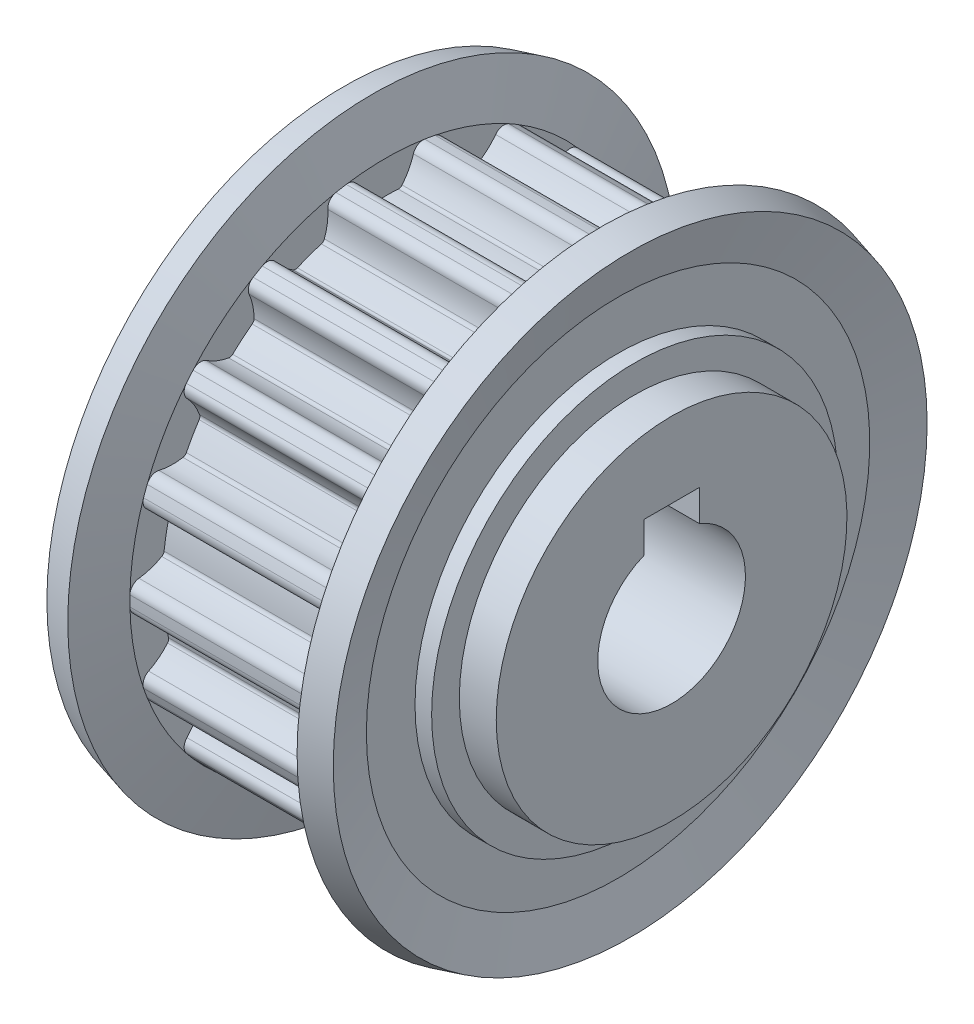
from build123d import *

# Parameters (mm, degrees)
SKETCH_2_W           = 25
SKETCH_2_H           = 4
CUT_EXTRUDE_1_DEPTH  = 11
CUT_EXTRUDE_2_DEPTH  = 11
CUT_EXTRUDE_3_DEPTH  = 11
CUT_EXTRUDE_4_DEPTH  = 11
CUT_EXTRUDE_5_DEPTH  = 11
CUT_EXTRUDE_6_DEPTH  = 11
CUT_EXTRUDE_7_DEPTH  = 11
CUT_EXTRUDE_8_DEPTH  = 11
CUT_EXTRUDE_9_DEPTH  = 11
CUT_EXTRUDE_10_DEPTH = 11
CUT_EXTRUDE_11_DEPTH = 11
CUT_EXTRUDE_12_DEPTH = 11
CUT_EXTRUDE_13_DEPTH = 11
CUT_EXTRUDE_14_DEPTH = 11
CUT_EXTRUDE_15_DEPTH = 11
CUT_EXTRUDE_16_DEPTH = 11
CUT_EXTRUDE_17_DEPTH = 11
CUT_EXTRUDE_18_DEPTH = 11
SKETCH_21_W          = 3
SKETCH_21_H          = 5.4
CUT_EXTRUDE_19_DEPTH = 25
SKETCH_22_W          = 1.621
SKETCH_22_H          = 9.5
SKETCH_24_W          = 7
SKETCH_24_H          = 9.5


with BuildPart() as part:
    # 스케치1 → 회전1 (revolve)
    with BuildSketch(Plane.XY):
        Polygon((0, 0), (0, 11), (0.9, 11), (0.9, 13.634356004), (0.243113572, 16.085889528), (1.788594894, 16.5), (2.5, 13.845), (13.5, 13.845), (14.211405106, 16.5), (15.756886428, 16.085889528), (15.1, 13.634356004), (15.1, 11), (16, 11), (16, 9.5), (25, 9.5), (25, 0), align=None)
    revolve(axis=Axis((25, 0, 0), (-1, 0, 0)))

    # 스케치2 → 컷-회전1 (revolve, cut)
    with BuildSketch(Plane.XY):
        with Locations((12.5, 2)):
            Rectangle(SKETCH_2_W, SKETCH_2_H)
    revolve(axis=Axis((25, 0, 0), (-1, 0, 0)), mode=Mode.SUBTRACT)

    # 스케치3 → 컷-돌출1 (cut)
    with BuildSketch(Plane(origin=(2.5, 0, 0), x_dir=(0, 0, -1), z_dir=(1, 0, 0))):
        with BuildLine():
            Line((2.1243151, 13.681056624), (2.1243151, 14.166612522))
            ThreePointArc((2.1243151, 14.166612522), (0, 14.325), (-2.1243151, 14.166612522))
            Line((-2.1243151, 14.166612522), (-2.1243151, 13.681056624))
            ThreePointArc((-2.1243151, 13.681056624), (-1.746277471, 13.602618612), (-1.512942792, 13.295015136))
            ThreePointArc((-1.512942792, 13.295015136), (-1.263642967, 12.689365371), (-0.89881438, 12.145433258))
            ThreePointArc((-0.89881438, 12.145433258), (-0.806096067, 12.075598583), (-0.691833137, 12.055164533))
            ThreePointArc((-0.691833137, 12.055164533), (-6e-09, 12.075), (0.691833126, 12.055164533))
            ThreePointArc((0.691833126, 12.055164533), (0.806096062, 12.07559858), (0.89881438, 12.145433258))
            ThreePointArc((0.89881438, 12.145433258), (1.263642967, 12.689365371), (1.512942792, 13.295015136))
            ThreePointArc((1.512942792, 13.295015136), (1.746277471, 13.602618612), (2.1243151, 13.681056624))
        make_face()
    extrude(amount=CUT_EXTRUDE_1_DEPTH, mode=Mode.SUBTRACT)

    # 스케치4 → 컷-돌출2 (cut)
    with BuildSketch(Plane(origin=(2.5, 0, 0), x_dir=(0, 0, -1), z_dir=(1, 0, 0))):
        with BuildLine():
            Line((6.675400171, 12.1294294), (6.841470069, 12.585702694))
            ThreePointArc((6.841470069, 12.585702694), (4.899438553, 13.461096793), (2.849063622, 14.038819804))
            Line((2.849063622, 14.038819804), (2.682993724, 13.582546509))
            ThreePointArc((2.682993724, 13.582546509), (3.011405514, 13.379542404), (3.125461805, 13.010684527))
            ThreePointArc((3.125461805, 13.010684527), (3.152582591, 12.35629435), (3.309373584, 11.720386632))
            ThreePointArc((3.309373584, 11.720386632), (3.372615432, 11.623051972), (3.472998607, 11.564770023))
            ThreePointArc((3.472998607, 11.564770023), (4.129893225, 11.346788398), (4.773219585, 11.091528289))
            ThreePointArc((4.773219585, 11.091528289), (4.887580478, 11.071649787), (4.998592064, 11.105561386))
            ThreePointArc((4.998592064, 11.105561386), (5.527454534, 11.491911653), (5.96886416, 11.975770706))
            ThreePointArc((5.96886416, 11.975770706), (6.29333362, 12.185018263), (6.675400171, 12.1294294))
        make_face()
    extrude(amount=CUT_EXTRUDE_2_DEPTH, mode=Mode.SUBTRACT)

    # 스케치5 → 컷-돌출3 (cut)
    with BuildSketch(Plane(origin=(2.5, 0, 0), x_dir=(0, 0, -1), z_dir=(1, 0, 0))):
        with BuildLine():
            Line((10.421333463, 9.114813978), (10.733442778, 9.486771375))
            ThreePointArc((10.733442778, 9.486771375), (9.207932509, 10.973586648), (7.478803223, 12.217738226))
            Line((7.478803223, 12.217738226), (7.166693908, 11.845780828))
            ThreePointArc((7.166693908, 11.845780828), (7.405868551, 11.542695921), (7.386889582, 11.157073347))
            ThreePointArc((7.386889582, 11.157073347), (7.188560162, 10.532871871), (7.118402252, 9.881688403))
            ThreePointArc((7.118402252, 9.881688403), (7.144539736, 9.768593756), (7.218935464, 9.67949357))
            ThreePointArc((7.218935464, 9.67949357), (7.761660383, 9.249986654), (8.278885317, 8.79009004))
            ThreePointArc((8.278885317, 8.79009004), (8.379550556, 8.732296629), (8.495465774, 8.72619491))
            ThreePointArc((8.495465774, 8.72619491), (9.124573508, 8.908363787), (9.704852419, 9.212071586))
            ThreePointArc((9.704852419, 9.212071586), (10.081320856, 9.297724879), (10.421333463, 9.114813978))
        make_face()
    extrude(amount=CUT_EXTRUDE_3_DEPTH, mode=Mode.SUBTRACT)

    # 스케치6 → 컷-돌출4 (cut)
    with BuildSketch(Plane(origin=(2.5, 0, 0), x_dir=(0, 0, -1), z_dir=(1, 0, 0))):
        with BuildLine():
            Line((12.910300137, 5.00081747), (13.33080388, 5.243595419))
            ThreePointArc((13.33080388, 5.243595419), (12.405813909, 7.1625), (11.20648878, 8.923017103))
            Line((11.20648878, 8.923017103), (10.785985037, 8.680239154))
            ThreePointArc((10.785985037, 8.680239154), (10.907074541, 8.313629958), (10.757349456, 7.95775446))
            ThreePointArc((10.757349456, 7.95775446), (10.357491286, 7.439029596), (10.068846552, 6.851112715))
            ThreePointArc((10.068846552, 6.851112715), (10.054727105, 6.735898963), (10.094162163, 6.626727338))
            ThreePointArc((10.094162163, 6.626727338), (10.457256748, 6.037500005), (10.785995296, 5.428437204))
            ThreePointArc((10.785995296, 5.428437204), (10.860823167, 5.339699623), (10.967660932, 5.294320543))
            ThreePointArc((10.967660932, 5.294320543), (11.621134253, 5.250335775), (12.270292248, 5.337260676))
            ThreePointArc((12.270292248, 5.337260676), (12.653352012, 5.288988655), (12.910300137, 5.00081747))
        make_face()
    extrude(amount=CUT_EXTRUDE_4_DEPTH, mode=Mode.SUBTRACT)

    # 스케치7 → 컷-돌출5 (cut)
    with BuildSketch(Plane(origin=(2.5, 0, 0), x_dir=(0, 0, -1), z_dir=(1, 0, 0))):
        with BuildLine():
            Line((13.842094079, 0.283648571), (14.320273292, 0.367964468))
            ThreePointArc((14.320273292, 0.367964468), (14.107371062, 2.487510145), (13.5825064, 4.552048428))
            Line((13.5825064, 4.552048428), (13.104327187, 4.467732531))
            ThreePointArc((13.104327187, 4.467732531), (13.09272637, 4.081817526), (12.830314224, 3.798612942))
            ThreePointArc((12.830314224, 3.798612942), (12.2771561, 3.447930563), (11.804839357, 2.994191722))
            ThreePointArc((11.804839357, 2.994191722), (11.752165994, 2.890755344), (11.751883932, 2.77467999))
            ThreePointArc((11.751883932, 2.77467999), (11.891553617, 2.096801751), (11.992155058, 1.412034726))
            ThreePointArc((11.992155058, 1.412034726), (12.032120216, 1.303056037), (12.116994316, 1.223872983))
            ThreePointArc((12.116994316, 1.223872983), (12.716014696, 0.959039781), (13.355753741, 0.818697359))
            ThreePointArc((13.355753741, 0.818697359), (13.699202171, 0.642322342), (13.842094079, 0.283648571))
        make_face()
    extrude(amount=CUT_EXTRUDE_5_DEPTH, mode=Mode.SUBTRACT)

    # 스케치8 → 컷-돌출6 (cut)
    with BuildSketch(Plane(origin=(2.5, 0, 0), x_dir=(0, 0, -1), z_dir=(1, 0, 0))):
        with BuildLine():
            Line((13.104327187, -4.467732531), (13.5825064, -4.552048428))
            ThreePointArc((13.5825064, -4.552048428), (14.107371062, -2.487510145), (14.320273292, -0.367964468))
            Line((14.320273292, -0.367964468), (13.842094079, -0.283648571))
            ThreePointArc((13.842094079, -0.283648571), (13.699202171, -0.642322342), (13.355753741, -0.818697359))
            ThreePointArc((13.355753741, -0.818697359), (12.716014696, -0.959039781), (12.116994316, -1.223872983))
            ThreePointArc((12.116994316, -1.223872983), (12.03212022, -1.303056032), (11.992155059, -1.412034715))
            ThreePointArc((11.992155059, -1.412034715), (11.891553619, -2.09680174), (11.751883935, -2.774679979))
            ThreePointArc((11.751883935, -2.774679979), (11.752165992, -2.890755339), (11.804839357, -2.994191722))
            ThreePointArc((11.804839357, -2.994191722), (12.2771561, -3.447930563), (12.830314224, -3.798612942))
            ThreePointArc((12.830314224, -3.798612942), (13.09272637, -4.081817526), (13.104327187, -4.467732531))
        make_face()
    extrude(amount=CUT_EXTRUDE_6_DEPTH, mode=Mode.SUBTRACT)

    # 스케치9 → 컷-돌출7 (cut)
    with BuildSketch(Plane(origin=(2.5, 0, 0), x_dir=(0, 0, -1), z_dir=(1, 0, 0))):
        with BuildLine():
            Line((10.785985037, -8.680239154), (11.20648878, -8.923017103))
            ThreePointArc((11.20648878, -8.923017103), (12.405813909, -7.1625), (13.33080388, -5.243595419))
            Line((13.33080388, -5.243595419), (12.910300137, -5.00081747))
            ThreePointArc((12.910300137, -5.00081747), (12.653352012, -5.288988655), (12.270292248, -5.337260676))
            ThreePointArc((12.270292248, -5.337260676), (11.621134253, -5.250335775), (10.967660932, -5.294320543))
            ThreePointArc((10.967660932, -5.294320543), (10.860823172, -5.33969962), (10.785995301, -5.428437194))
            ThreePointArc((10.785995301, -5.428437194), (10.457256753, -6.037499995), (10.09416217, -6.626727329))
            ThreePointArc((10.09416217, -6.626727329), (10.054727106, -6.735898958), (10.068846552, -6.851112715))
            ThreePointArc((10.068846552, -6.851112715), (10.357491286, -7.439029596), (10.757349456, -7.95775446))
            ThreePointArc((10.757349456, -7.95775446), (10.907074541, -8.313629958), (10.785985037, -8.680239154))
        make_face()
    extrude(amount=CUT_EXTRUDE_7_DEPTH, mode=Mode.SUBTRACT)

    # 스케치10 → 컷-돌출8 (cut)
    with BuildSketch(Plane(origin=(2.5, 0, 0), x_dir=(0, 0, -1), z_dir=(1, 0, 0))):
        with BuildLine():
            Line((7.166693908, -11.845780828), (7.478803223, -12.217738226))
            ThreePointArc((7.478803223, -12.217738226), (9.207932509, -10.973586648), (10.733442778, -9.486771375))
            Line((10.733442778, -9.486771375), (10.421333463, -9.114813978))
            ThreePointArc((10.421333463, -9.114813978), (10.081320856, -9.297724879), (9.704852419, -9.212071586))
            ThreePointArc((9.704852419, -9.212071586), (9.124573508, -8.908363787), (8.495465774, -8.72619491))
            ThreePointArc((8.495465774, -8.72619491), (8.379550561, -8.732296628), (8.278885325, -8.790090033))
            ThreePointArc((8.278885325, -8.790090033), (7.761660391, -9.249986647), (7.218935473, -9.679493563))
            ThreePointArc((7.218935473, -9.679493563), (7.144539738, -9.768593751), (7.118402252, -9.881688403))
            ThreePointArc((7.118402252, -9.881688403), (7.188560162, -10.532871871), (7.386889582, -11.157073347))
            ThreePointArc((7.386889582, -11.157073347), (7.405868551, -11.542695921), (7.166693908, -11.845780828))
        make_face()
    extrude(amount=CUT_EXTRUDE_8_DEPTH, mode=Mode.SUBTRACT)

    # 스케치11 → 컷-돌출9 (cut)
    with BuildSketch(Plane(origin=(2.5, 0, 0), x_dir=(0, 0, -1), z_dir=(1, 0, 0))):
        with BuildLine():
            Line((2.682993724, -13.582546509), (2.849063622, -14.038819804))
            ThreePointArc((2.849063622, -14.038819804), (4.899438553, -13.461096793), (6.841470069, -12.585702694))
            Line((6.841470069, -12.585702694), (6.675400171, -12.1294294))
            ThreePointArc((6.675400171, -12.1294294), (6.29333362, -12.185018263), (5.96886416, -11.975770706))
            ThreePointArc((5.96886416, -11.975770706), (5.527454534, -11.491911653), (4.998592064, -11.105561386))
            ThreePointArc((4.998592064, -11.105561386), (4.887580484, -11.071649787), (4.773219595, -11.091528285))
            ThreePointArc((4.773219595, -11.091528285), (4.129893236, -11.346788394), (3.472998618, -11.564770019))
            ThreePointArc((3.472998618, -11.564770019), (3.372615436, -11.623051968), (3.309373584, -11.720386632))
            ThreePointArc((3.309373584, -11.720386632), (3.152582591, -12.35629435), (3.125461805, -13.010684527))
            ThreePointArc((3.125461805, -13.010684527), (3.011405514, -13.379542404), (2.682993724, -13.582546509))
        make_face()
    extrude(amount=CUT_EXTRUDE_9_DEPTH, mode=Mode.SUBTRACT)

    # 스케치12 → 컷-돌출10 (cut)
    with BuildSketch(Plane(origin=(2.5, 0, 0), x_dir=(0, 0, -1), z_dir=(1, 0, 0))):
        with BuildLine():
            Line((-2.1243151, -13.681056624), (-2.1243151, -14.166612522))
            ThreePointArc((-2.1243151, -14.166612522), (0, -14.325), (2.1243151, -14.166612522))
            Line((2.1243151, -14.166612522), (2.1243151, -13.681056624))
            ThreePointArc((2.1243151, -13.681056624), (1.746277471, -13.602618612), (1.512942792, -13.295015136))
            ThreePointArc((1.512942792, -13.295015136), (1.263642967, -12.689365371), (0.89881438, -12.145433258))
            ThreePointArc((0.89881438, -12.145433258), (0.806096067, -12.075598583), (0.691833137, -12.055164533))
            ThreePointArc((0.691833137, -12.055164533), (6e-09, -12.075), (-0.691833126, -12.055164533))
            ThreePointArc((-0.691833126, -12.055164533), (-0.806096062, -12.07559858), (-0.89881438, -12.145433258))
            ThreePointArc((-0.89881438, -12.145433258), (-1.263642967, -12.689365371), (-1.512942792, -13.295015136))
            ThreePointArc((-1.512942792, -13.295015136), (-1.746277471, -13.602618612), (-2.1243151, -13.681056624))
        make_face()
    extrude(amount=CUT_EXTRUDE_10_DEPTH, mode=Mode.SUBTRACT)

    # 스케치13 → 컷-돌출11 (cut)
    with BuildSketch(Plane(origin=(2.5, 0, 0), x_dir=(0, 0, -1), z_dir=(1, 0, 0))):
        with BuildLine():
            Line((-6.675400171, -12.1294294), (-6.841470069, -12.585702694))
            ThreePointArc((-6.841470069, -12.585702694), (-4.899438553, -13.461096793), (-2.849063622, -14.038819804))
            Line((-2.849063622, -14.038819804), (-2.682993724, -13.582546509))
            ThreePointArc((-2.682993724, -13.582546509), (-3.011405514, -13.379542404), (-3.125461805, -13.010684527))
            ThreePointArc((-3.125461805, -13.010684527), (-3.152582591, -12.35629435), (-3.309373584, -11.720386632))
            ThreePointArc((-3.309373584, -11.720386632), (-3.372615432, -11.623051972), (-3.472998607, -11.564770023))
            ThreePointArc((-3.472998607, -11.564770023), (-4.129893225, -11.346788398), (-4.773219585, -11.091528289))
            ThreePointArc((-4.773219585, -11.091528289), (-4.887580478, -11.071649787), (-4.998592064, -11.105561386))
            ThreePointArc((-4.998592064, -11.105561386), (-5.527454534, -11.491911653), (-5.96886416, -11.975770706))
            ThreePointArc((-5.96886416, -11.975770706), (-6.29333362, -12.185018263), (-6.675400171, -12.1294294))
        make_face()
    extrude(amount=CUT_EXTRUDE_11_DEPTH, mode=Mode.SUBTRACT)

    # 스케치14 → 컷-돌출12 (cut)
    with BuildSketch(Plane(origin=(2.5, 0, 0), x_dir=(0, 0, -1), z_dir=(1, 0, 0))):
        with BuildLine():
            Line((-10.421333463, -9.114813978), (-10.733442778, -9.486771375))
            ThreePointArc((-10.733442778, -9.486771375), (-9.207932509, -10.973586648), (-7.478803223, -12.217738226))
            Line((-7.478803223, -12.217738226), (-7.166693908, -11.845780828))
            ThreePointArc((-7.166693908, -11.845780828), (-7.405868551, -11.542695921), (-7.386889582, -11.157073347))
            ThreePointArc((-7.386889582, -11.157073347), (-7.188560162, -10.532871871), (-7.118402252, -9.881688403))
            ThreePointArc((-7.118402252, -9.881688403), (-7.144539736, -9.768593756), (-7.218935464, -9.67949357))
            ThreePointArc((-7.218935464, -9.67949357), (-7.761660383, -9.249986654), (-8.278885317, -8.79009004))
            ThreePointArc((-8.278885317, -8.79009004), (-8.379550556, -8.732296629), (-8.495465774, -8.72619491))
            ThreePointArc((-8.495465774, -8.72619491), (-9.124573508, -8.908363787), (-9.704852419, -9.212071586))
            ThreePointArc((-9.704852419, -9.212071586), (-10.081320856, -9.297724879), (-10.421333463, -9.114813978))
        make_face()
    extrude(amount=CUT_EXTRUDE_12_DEPTH, mode=Mode.SUBTRACT)

    # 스케치15 → 컷-돌출13 (cut)
    with BuildSketch(Plane(origin=(2.5, 0, 0), x_dir=(0, 0, -1), z_dir=(1, 0, 0))):
        with BuildLine():
            Line((-12.910300137, -5.00081747), (-13.33080388, -5.243595419))
            ThreePointArc((-13.33080388, -5.243595419), (-12.405813909, -7.1625), (-11.20648878, -8.923017103))
            Line((-11.20648878, -8.923017103), (-10.785985037, -8.680239154))
            ThreePointArc((-10.785985037, -8.680239154), (-10.907074541, -8.313629958), (-10.757349456, -7.95775446))
            ThreePointArc((-10.757349456, -7.95775446), (-10.357491286, -7.439029596), (-10.068846552, -6.851112715))
            ThreePointArc((-10.068846552, -6.851112715), (-10.054727105, -6.735898963), (-10.094162163, -6.626727338))
            ThreePointArc((-10.094162163, -6.626727338), (-10.457256748, -6.037500005), (-10.785995296, -5.428437204))
            ThreePointArc((-10.785995296, -5.428437204), (-10.860823167, -5.339699623), (-10.967660932, -5.294320543))
            ThreePointArc((-10.967660932, -5.294320543), (-11.621134253, -5.250335775), (-12.270292248, -5.337260676))
            ThreePointArc((-12.270292248, -5.337260676), (-12.653352012, -5.288988655), (-12.910300137, -5.00081747))
        make_face()
    extrude(amount=CUT_EXTRUDE_13_DEPTH, mode=Mode.SUBTRACT)

    # 스케치16 → 컷-돌출14 (cut)
    with BuildSketch(Plane(origin=(2.5, 0, 0), x_dir=(0, 0, -1), z_dir=(1, 0, 0))):
        with BuildLine():
            Line((-13.842094079, -0.283648571), (-14.320273292, -0.367964468))
            ThreePointArc((-14.320273292, -0.367964468), (-14.107371062, -2.487510145), (-13.5825064, -4.552048428))
            Line((-13.5825064, -4.552048428), (-13.104327187, -4.467732531))
            ThreePointArc((-13.104327187, -4.467732531), (-13.09272637, -4.081817526), (-12.830314224, -3.798612942))
            ThreePointArc((-12.830314224, -3.798612942), (-12.2771561, -3.447930563), (-11.804839357, -2.994191722))
            ThreePointArc((-11.804839357, -2.994191722), (-11.752165994, -2.890755344), (-11.751883932, -2.77467999))
            ThreePointArc((-11.751883932, -2.77467999), (-11.891553617, -2.096801751), (-11.992155058, -1.412034726))
            ThreePointArc((-11.992155058, -1.412034726), (-12.032120216, -1.303056037), (-12.116994316, -1.223872983))
            ThreePointArc((-12.116994316, -1.223872983), (-12.716014696, -0.959039781), (-13.355753741, -0.818697359))
            ThreePointArc((-13.355753741, -0.818697359), (-13.699202171, -0.642322342), (-13.842094079, -0.283648571))
        make_face()
    extrude(amount=CUT_EXTRUDE_14_DEPTH, mode=Mode.SUBTRACT)

    # 스케치17 → 컷-돌출15 (cut)
    with BuildSketch(Plane(origin=(2.5, 0, 0), x_dir=(0, 0, -1), z_dir=(1, 0, 0))):
        with BuildLine():
            Line((-13.104327187, 4.467732531), (-13.5825064, 4.552048428))
            ThreePointArc((-13.5825064, 4.552048428), (-14.107371062, 2.487510145), (-14.320273292, 0.367964468))
            Line((-14.320273292, 0.367964468), (-13.842094079, 0.283648571))
            ThreePointArc((-13.842094079, 0.283648571), (-13.699202171, 0.642322342), (-13.355753741, 0.818697359))
            ThreePointArc((-13.355753741, 0.818697359), (-12.716014696, 0.959039781), (-12.116994316, 1.223872983))
            ThreePointArc((-12.116994316, 1.223872983), (-12.03212022, 1.303056032), (-11.992155059, 1.412034715))
            ThreePointArc((-11.992155059, 1.412034715), (-11.891553619, 2.09680174), (-11.751883935, 2.774679979))
            ThreePointArc((-11.751883935, 2.774679979), (-11.752165992, 2.890755339), (-11.804839357, 2.994191722))
            ThreePointArc((-11.804839357, 2.994191722), (-12.2771561, 3.447930563), (-12.830314224, 3.798612942))
            ThreePointArc((-12.830314224, 3.798612942), (-13.09272637, 4.081817526), (-13.104327187, 4.467732531))
        make_face()
    extrude(amount=CUT_EXTRUDE_15_DEPTH, mode=Mode.SUBTRACT)

    # 스케치18 → 컷-돌출16 (cut)
    with BuildSketch(Plane(origin=(2.5, 0, 0), x_dir=(0, 0, -1), z_dir=(1, 0, 0))):
        with BuildLine():
            Line((-10.785985037, 8.680239154), (-11.20648878, 8.923017103))
            ThreePointArc((-11.20648878, 8.923017103), (-12.405813909, 7.1625), (-13.33080388, 5.243595419))
            Line((-13.33080388, 5.243595419), (-12.910300137, 5.00081747))
            ThreePointArc((-12.910300137, 5.00081747), (-12.653352012, 5.288988655), (-12.270292248, 5.337260676))
            ThreePointArc((-12.270292248, 5.337260676), (-11.621134253, 5.250335775), (-10.967660932, 5.294320543))
            ThreePointArc((-10.967660932, 5.294320543), (-10.860823172, 5.33969962), (-10.785995301, 5.428437194))
            ThreePointArc((-10.785995301, 5.428437194), (-10.457256753, 6.037499995), (-10.09416217, 6.626727329))
            ThreePointArc((-10.09416217, 6.626727329), (-10.054727106, 6.735898958), (-10.068846552, 6.851112715))
            ThreePointArc((-10.068846552, 6.851112715), (-10.357491286, 7.439029596), (-10.757349456, 7.95775446))
            ThreePointArc((-10.757349456, 7.95775446), (-10.907074541, 8.313629958), (-10.785985037, 8.680239154))
        make_face()
    extrude(amount=CUT_EXTRUDE_16_DEPTH, mode=Mode.SUBTRACT)

    # 스케치19 → 컷-돌출17 (cut)
    with BuildSketch(Plane(origin=(2.5, 0, 0), x_dir=(0, 0, -1), z_dir=(1, 0, 0))):
        with BuildLine():
            Line((-7.166693908, 11.845780828), (-7.478803223, 12.217738226))
            ThreePointArc((-7.478803223, 12.217738226), (-9.207932509, 10.973586648), (-10.733442778, 9.486771375))
            Line((-10.733442778, 9.486771375), (-10.421333463, 9.114813978))
            ThreePointArc((-10.421333463, 9.114813978), (-10.081320856, 9.297724879), (-9.704852419, 9.212071586))
            ThreePointArc((-9.704852419, 9.212071586), (-9.124573508, 8.908363787), (-8.495465774, 8.72619491))
            ThreePointArc((-8.495465774, 8.72619491), (-8.379550561, 8.732296628), (-8.278885325, 8.790090033))
            ThreePointArc((-8.278885325, 8.790090033), (-7.761660391, 9.249986647), (-7.218935473, 9.679493563))
            ThreePointArc((-7.218935473, 9.679493563), (-7.144539738, 9.768593751), (-7.118402252, 9.881688403))
            ThreePointArc((-7.118402252, 9.881688403), (-7.188560162, 10.532871871), (-7.386889582, 11.157073347))
            ThreePointArc((-7.386889582, 11.157073347), (-7.405868551, 11.542695921), (-7.166693908, 11.845780828))
        make_face()
    extrude(amount=CUT_EXTRUDE_17_DEPTH, mode=Mode.SUBTRACT)

    # 스케치20 → 컷-돌출18 (cut)
    with BuildSketch(Plane(origin=(2.5, 0, 0), x_dir=(0, 0, -1), z_dir=(1, 0, 0))):
        with BuildLine():
            Line((-2.682993724, 13.582546509), (-2.849063622, 14.038819804))
            ThreePointArc((-2.849063622, 14.038819804), (-4.899438553, 13.461096793), (-6.841470069, 12.585702694))
            Line((-6.841470069, 12.585702694), (-6.675400171, 12.1294294))
            ThreePointArc((-6.675400171, 12.1294294), (-6.29333362, 12.185018263), (-5.96886416, 11.975770706))
            ThreePointArc((-5.96886416, 11.975770706), (-5.527454534, 11.491911653), (-4.998592064, 11.105561386))
            ThreePointArc((-4.998592064, 11.105561386), (-4.887580484, 11.071649787), (-4.773219595, 11.091528285))
            ThreePointArc((-4.773219595, 11.091528285), (-4.129893236, 11.346788394), (-3.472998618, 11.564770019))
            ThreePointArc((-3.472998618, 11.564770019), (-3.372615436, 11.623051968), (-3.309373584, 11.720386632))
            ThreePointArc((-3.309373584, 11.720386632), (-3.152582591, 12.35629435), (-3.125461805, 13.010684527))
            ThreePointArc((-3.125461805, 13.010684527), (-3.011405514, 13.379542404), (-2.682993724, 13.582546509))
        make_face()
    extrude(amount=CUT_EXTRUDE_18_DEPTH, mode=Mode.SUBTRACT)

    # 스케치21 → 컷-돌출19 (cut)
    with BuildSketch(Plane(origin=(0, 0, 0), x_dir=(0, 0, -1), z_dir=(1, 0, 0))):
        with Locations((0, 2.7)):
            Rectangle(SKETCH_21_W, SKETCH_21_H)
    extrude(amount=CUT_EXTRUDE_19_DEPTH, mode=Mode.SUBTRACT)

    # 스케치22 → 컷-회전2 (revolve, cut)
    with BuildSketch(Plane(origin=(20.5, 0, 0), x_dir=(0, 0, -1), z_dir=(1, 0, 0))):
        with Locations((0.8105, 4.75)):
            Rectangle(SKETCH_22_W, SKETCH_22_H)
    revolve(axis=Axis((20.5, 0, 0), (0, 1, 0)), mode=Mode.SUBTRACT)

    # 스케치23 → 컷-회전3 (revolve, cut)
    with BuildSketch(Plane(origin=(20.5, 0, 0), x_dir=(0, 0, -1), z_dir=(1, 0, 0))):
        Polygon((8.227241336, -4.75), (7.416741336, -6.15382718), (-0.8105, -1.40382718), (0, 0), align=None)
    revolve(axis=Axis((20.5, 0, 0), (0, -0.49999999999999856, -0.8660254037844396)), mode=Mode.SUBTRACT)

    # 스케치24 → 컷-회전4 (revolve, cut)
    with BuildSketch(Plane.XY):
        with Locations((21.5, 4.75)):
            Rectangle(SKETCH_24_W, SKETCH_24_H)
    revolve(axis=Axis((25, 0, 0), (-1, 0, 0)), mode=Mode.SUBTRACT)


solid = part.part
